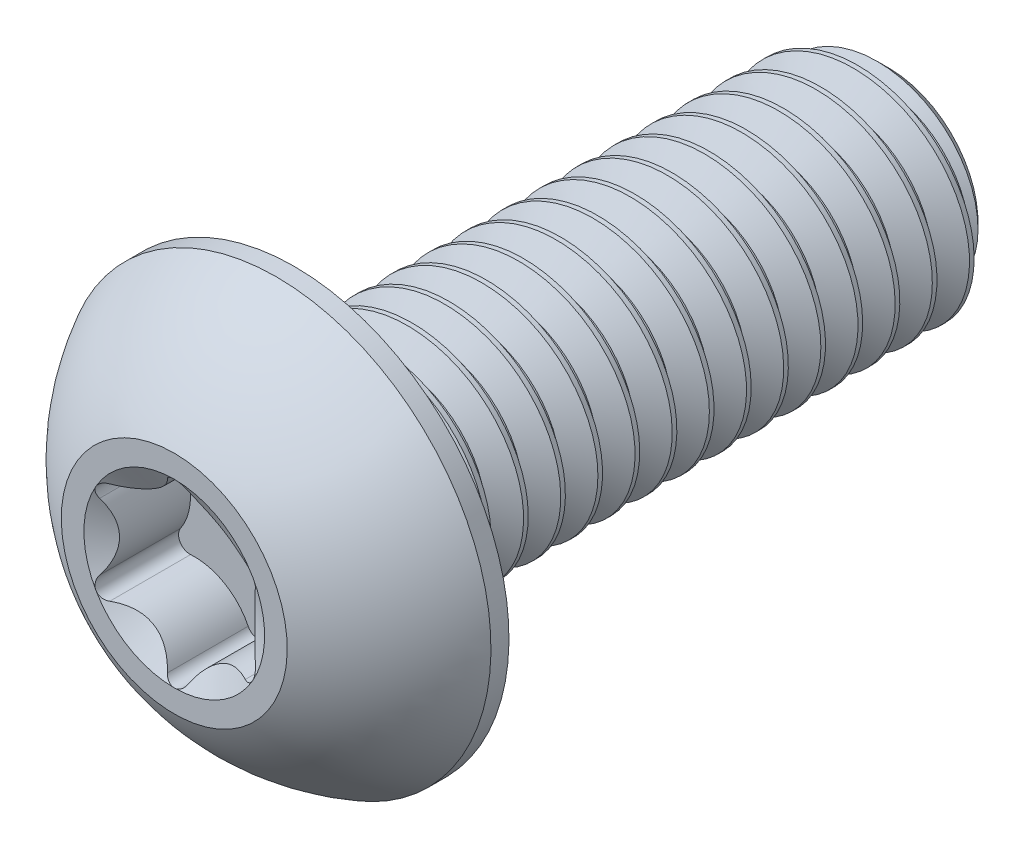
from build123d import *

# Parameters (mm, degrees)
CUT_EXTRUDE1_DEPTH = 1.79578
CIRPATTERN1_COUNT  = 6
CUT_SWEEP1_PITCH   = 0.79375
CUT_SWEEP1_TO      = 12.7


with BuildPart() as part:
    # Sketch3 → Revolve1 (revolve)
    with BuildSketch(Plane(origin=(0, 0, 0), x_dir=(0, 0, -1), z_dir=(1, 0, 0))):
        with BuildLine():
            Line((2.18059, 4.5847), (2.5654, 4.5847))
            Line((2.5654, 4.5847), (2.5654, 2.413))
            Line((2.5654, 2.413), (14.756013458, 2.413))
            Line((14.756013458, 2.413), (15.2654, 1.903613458))
            Line((15.2654, 1.903613458), (15.2654, 0))
            Line((15.2654, 0), (0, 0))
            Line((0, 0), (0, 2.413))
            ThreePointArc((0, 2.413), (0.925030326, 3.664791196), (2.18059, 4.5847))
        make_face()
    revolve(axis=Axis((0, 0, -15.2654), (0, 0, 1)))

    # Sketch4 → Cut-Extrude1 (cut)
    with BuildSketch(Plane.XY):
        with BuildLine():
            Line((0, 0), (-1.671775439, -0.9652))
            ThreePointArc((-1.671775439, -0.9652), (-1.703973353, -0.836625581), (-1.663404542, -0.710442149))
            ThreePointArc((-1.663404542, -0.710442149), (-1.4478, 0), (-1.663404542, 0.710442149))
            ThreePointArc((-1.663404542, 0.710442149), (-1.703973353, 0.836625581), (-1.671775439, 0.9652))
            Line((-1.671775439, 0.9652), (0, 0))
        make_face()
    cut_extrude1 = extrude(amount=-CUT_EXTRUDE1_DEPTH, mode=Mode.SUBTRACT)

    # CirPattern1: Cut-Extrude1 ×6 about axis
    cirpattern1_axis = Axis((0, 0, 0), (0, 0, 1))
    for i in range(1, CIRPATTERN1_COUNT):
        add(cut_extrude1.rotate(cirpattern1_axis, i * 360 / CIRPATTERN1_COUNT), mode=Mode.SUBTRACT)

    # Cut-Extrude2 cone 1 section (through the dimple's axis) → Cut-Extrude2 (revolve, cut)
    with BuildSketch(Plane(origin=(0, 0, 0), x_dir=(0, -1, 0), z_dir=(1, 0, 0))):
        Polygon((0, 0), (1.9304, 0), (0, 1.11451696), align=None)
    revolve(axis=Axis((0, 0, 0), (0, 0, -1)), mode=Mode.SUBTRACT)


with BuildPart() as body_2:
    # Split1: read off the stored shape, not the designer's step
    # Split1: the piece on the far side of the plane
    add(part.part)
    split(bisect_by=Plane.XY.offset(-2.5654), keep=Keep.BOTTOM)

    # Cut-Sweep1: arcs per turn and ends read off the stored shape
    # Cut-Sweep1: the profile of Sketch7 screwed along a right-hand helix through 17 turns, 8 arcs to a turn; built about Z, then put on its axis
    cut_sweep1_z = Axis((0, 0, 0), (0, 0, 1))
    cut_sweep1_corners = [(1.897444252, 0, -0.29765625), (1.897444252, 0, -0.396875), (2.455962979, 0, -0.719335937), (2.455962979, 0, 0.024804688)]
    with BuildLine(mode=Mode.PRIVATE) as cut_sweep1_profile:
        Line(cut_sweep1_corners[0], cut_sweep1_corners[1])
        Line(cut_sweep1_corners[1], cut_sweep1_corners[2])
        Line(cut_sweep1_corners[2], cut_sweep1_corners[3])
        Line(cut_sweep1_corners[3], cut_sweep1_corners[0])
    cut_sweep1_cap = Face(cut_sweep1_profile.wire())
    cut_sweep1_turn_angles = [0, 22.5, 45, 67.5, 90, 112.5, 135, 157.5, 180, 202.5, 225, 247.5, 270, 292.5, 315, 337.5, 360]
    cut_sweep1_turn_weights = [1, 0.9238795325112867, 1, 0.9238795325112867, 1, 0.9238795325112867, 1, 0.9238795325112867, 1, 0.9238795325112867, 1, 0.9238795325112867, 1, 0.9238795325112867, 1, 0.9238795325112867, 1]
    cut_sweep1_turn_rails = [Edge.make_bspline([Vector(p[0], p[1], 0).rotate(cut_sweep1_z, cut_sweep1_turn_angles[k]) / cut_sweep1_turn_weights[k] + Vector(0, 0, p[2] + CUT_SWEEP1_PITCH * cut_sweep1_turn_angles[k] / 360) for k in range(17)], [0, 0, 0, 1, 1, 2, 2, 3, 3, 4, 4, 5, 5, 6, 6, 7, 7, 8, 8, 8], 2, cut_sweep1_turn_weights) for p in cut_sweep1_corners]
    cut_sweep1_turn_sides = [Face.make_surface_from_curves(cut_sweep1_turn_rails[p[0]], cut_sweep1_turn_rails[p[1]]) for p in [(0, 1), (1, 2), (2, 3), (3, 0)]]
    cut_sweep1 = Plane(origin=(0, 0, -15.2654), x_dir=(0, 1, 0), z_dir=(0, 0, 1)) * split(Solid(Shell([*[p.moved(Location((0, 0, CUT_SWEEP1_PITCH * i))) for i in range(17) for p in cut_sweep1_turn_sides], cut_sweep1_cap, cut_sweep1_cap.rotate(cut_sweep1_z, 6120).moved(Location((0, 0, CUT_SWEEP1_PITCH * 6120 / 360)))])), bisect_by=Plane.XY.offset(CUT_SWEEP1_TO), keep=Keep.BOTTOM, mode=Mode.PRIVATE)
    add(cut_sweep1, mode=Mode.SUBTRACT)


with BuildPart() as part_1:
    add(part.part)

    # Split1
    split(bisect_by=Plane.XY.offset(-2.5654), keep=Keep.TOP)


with BuildPart() as body_2_1:
    add(body_2.part)

    # Combine1: union part
    add(part_1.part)


solid = body_2_1.part
